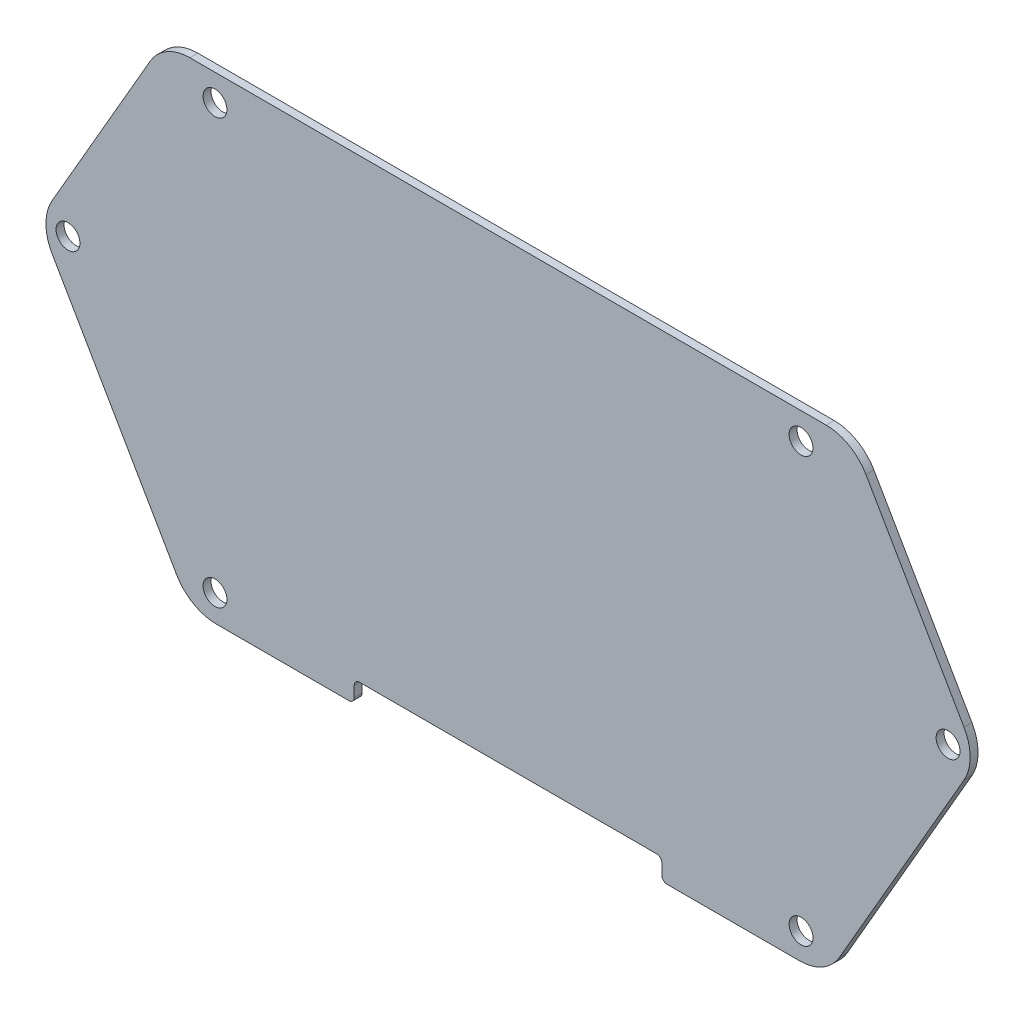
from build123d import *

# Parameters (mm, degrees)
FLANGE_BASE1_DEPTH    = 1.5
ESBO_O7_R             = 2.25
CORTE_EXTRUS_O1_DEPTH = 10
CORTE_EXTRUS_O3_DEPTH = 10
CORTE_EXTRUS_O4_DEPTH = 10


# Sheet-metal steps are written as plain solids
with BuildPart() as part:
    # Esboço2 → Flange-base1 (new body)
    with BuildSketch(Plane.XY):
        Polygon((60, -49.330127019), (-60, -49.330127019), (-88.480762114, 0), (-65, 40.669872981), (65, 40.669872981), (88.480762114, 0), align=None)
    extrude(amount=-FLANGE_BASE1_DEPTH)

    # Esboço7 → Corte-extrusão1 (cut)
    with BuildSketch(Plane(origin=(0, 0, -1.5), x_dir=(-1, 0, 0), z_dir=(0, 0, -1))):
        with Locations((-82.980762114, 0)):
            Circle(ESBO_O7_R)
        with Locations((-55.257737945, -44.330127019)):
            Circle(ESBO_O7_R)
        with Locations((55.257737945, -44.330127019)):
            Circle(ESBO_O7_R)
        with Locations((82.980762114, 0)):
            Circle(ESBO_O7_R)
        with Locations((55.257737945, 35.669872981)):
            Circle(ESBO_O7_R)
        with Locations((-55.257737945, 35.669872981)):
            Circle(ESBO_O7_R)
    extrude(amount=-CORTE_EXTRUS_O1_DEPTH, mode=Mode.SUBTRACT)

    # Esboço8 → Corte-extrusão3 (cut)
    with BuildSketch(Plane.XY):
        with BuildLine():
            Line((-85.980762114, -4.330127019), (-62.5, -45))
            ThreePointArc((-62.5, -45), (-59.330127019, -48.169872981), (-55, -49.330127019))
            Line((-55, -49.330127019), (-88.480762114, -49.330127019))
            Line((-88.480762114, -49.330127019), (-88.480762114, 40.669872981))
            Line((-88.480762114, 40.669872981), (-60, 40.669872981))
            ThreePointArc((-60, 40.669872981), (-64.330127019, 39.509618943), (-67.5, 36.339745962))
            Line((-67.5, 36.339745962), (-85.980762114, 4.330127019))
            ThreePointArc((-85.980762114, 4.330127019), (-87.141016151, 0), (-85.980762114, -4.330127019))
        make_face()
    corte_extrus_o3 = extrude(amount=-CORTE_EXTRUS_O3_DEPTH, mode=Mode.SUBTRACT)

    # Espelhar1: Corte-extrusão3 across plane
    add(corte_extrus_o3.mirror(Plane(origin=(0, 0, 0), x_dir=(0, 0, 1), z_dir=(1, 0, 0))), mode=Mode.SUBTRACT)

    # Esboço9 → Corte-extrusão4 (cut)
    with BuildSketch(Plane.XY):
        with BuildLine():
            Line((-29, -48.330127019), (-29, -46.330127019))
            ThreePointArc((-29, -46.330127019), (-28.707106781, -45.623020238), (-28, -45.330127019))
            Line((-28, -45.330127019), (28, -45.330127019))
            ThreePointArc((28, -45.330127019), (28.707106781, -45.623020238), (29, -46.330127019))
            Line((29, -46.330127019), (29, -48.330127019))
            ThreePointArc((29, -48.330127019), (29.292893219, -49.0372338), (30, -49.330127019))
            Line((30, -49.330127019), (-30, -49.330127019))
            ThreePointArc((-30, -49.330127019), (-29.292893219, -49.0372338), (-29, -48.330127019))
        make_face()
    extrude(amount=-CORTE_EXTRUS_O4_DEPTH, mode=Mode.SUBTRACT)


solid = part.part
